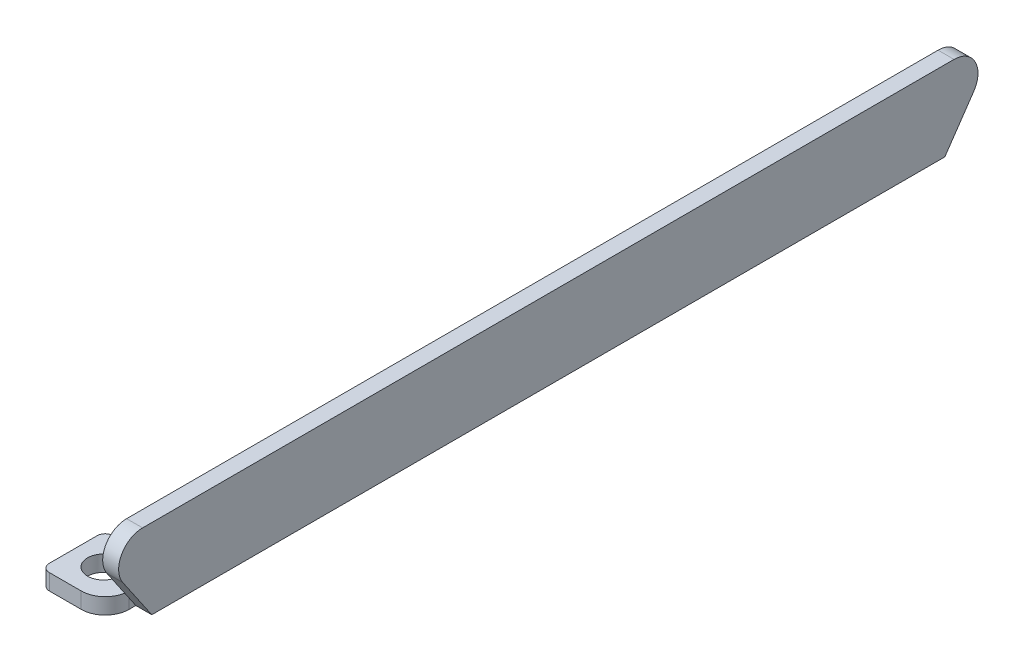
from build123d import *

# Parameters (mm, degrees)
BASE_FLANGE1_DEPTH               = 2
FILLET1_R                        = 3
BOSS_EXTRUDE1_START              = 29.3979
BOSS_EXTRUDE1_DEPTH              = 2
F_4_0_START                      = 29.397900258
F_4_0_4_DIAMETER_HOLE1_OUTLINE_R = 2
F_4_0_4_DIAMETER_HOLE1_DEPTH     = 2
FILLET2_R                        = 3


# Read off the part's stored shape, not the designer's step: Ø4.0 (4) Diameter Hole1
# Sheet-metal steps are written as plain solids
with BuildPart() as part:
    # Sketch1 → Base-Flange1 (new body)
    with BuildSketch(Plane(origin=(0, 0, 0), x_dir=(0, 0, -1), z_dir=(1, 0, 0))):
        Polygon((49.662255386, 29.397900258), (56.5, 39.397900258), (-56.5, 39.397900258), (-49.662255386, 29.397900258), align=None)
    extrude(amount=-BASE_FLANGE1_DEPTH)

    # Fillet1
    fillet1_edges = [part.edges().sort_by_distance(p)[0] for p in [
        (-1, 39.397900258, 56.5),
        (-1, 39.397900258, -56.5),
    ]]
    fillet(fillet1_edges, radius=FILLET1_R)

    # Sketch2 → Boss-Extrude1 (add)
    with BuildSketch(Plane(origin=(0, 0, 0), x_dir=(1, 0, 0), z_dir=(0, 1, 0)).offset(BOSS_EXTRUDE1_START)):
        with BuildLine():
            Line((-2, 53.5), (-9, 53.5))
            ThreePointArc((-9, 53.5), (-9.707106781, 53.207106781), (-10, 52.5))
            Line((-10, 52.5), (-10, 46.5))
            ThreePointArc((-10, 46.5), (-9.707106781, 45.792893219), (-9, 45.5))
            Line((-9, 45.5), (-2, 45.5))
            Line((-2, 45.5), (-2, 53.5))
        make_face()
        with BuildLine():
            Line((-10, -52.5), (-10, -46.5))
            ThreePointArc((-10, -46.5), (-9.707106781, -45.792893219), (-9, -45.5))
            Line((-9, -45.5), (-2, -45.5))
            Line((-2, -45.5), (-2, -53.5))
            Line((-2, -53.5), (-9, -53.5))
            ThreePointArc((-9, -53.5), (-9.707106781, -53.207106781), (-10, -52.5))
        make_face()
    extrude(amount=BOSS_EXTRUDE1_DEPTH)

    # Ø4.0 (4) Diameter Hole1 outline → Ø4.0 (4) Diameter Hole1 (cut)
    with BuildSketch(Plane(origin=(0, 0, 0), x_dir=(1, 0, 0), z_dir=(0, 1, 0)).offset(F_4_0_START)):
        with Locations((-6.20230671, -49.5)):
            Circle(F_4_0_4_DIAMETER_HOLE1_OUTLINE_R)
        with Locations((-6.20230671, 49.5)):
            Circle(F_4_0_4_DIAMETER_HOLE1_OUTLINE_R)
    extrude(amount=F_4_0_4_DIAMETER_HOLE1_DEPTH, mode=Mode.SUBTRACT)

    # Fillet2
    # the kernel refuses this fillet: 3 mm, written as the material it takes off along each edge
    with BuildSketch(Plane(origin=(-2, 21.8979, -53.5), x_dir=(0, 0, 1), z_dir=(0, 1, 0))) as fillet2_piece_1:
        with BuildLine():
            CenterArc((FILLET2_R, -FILLET2_R), FILLET2_R, 90, 90)
            Line((0, -FILLET2_R), (0, 0))
            Line((0, 0), (FILLET2_R, 0))
        make_face()
    extrude(amount=17, mode=Mode.SUBTRACT)
    with BuildSketch(Plane(origin=(-2, 21.8979, 53.5), x_dir=(0, 0, -1), z_dir=(0, 1, 0))) as fillet2_piece_2:
        with BuildLine():
            CenterArc((FILLET2_R, FILLET2_R), FILLET2_R, 180, 90)
            Line((0, FILLET2_R), (0, 0))
            Line((0, 0), (FILLET2_R, 0))
        make_face()
    extrude(amount=17, mode=Mode.SUBTRACT)


solid = part.part
